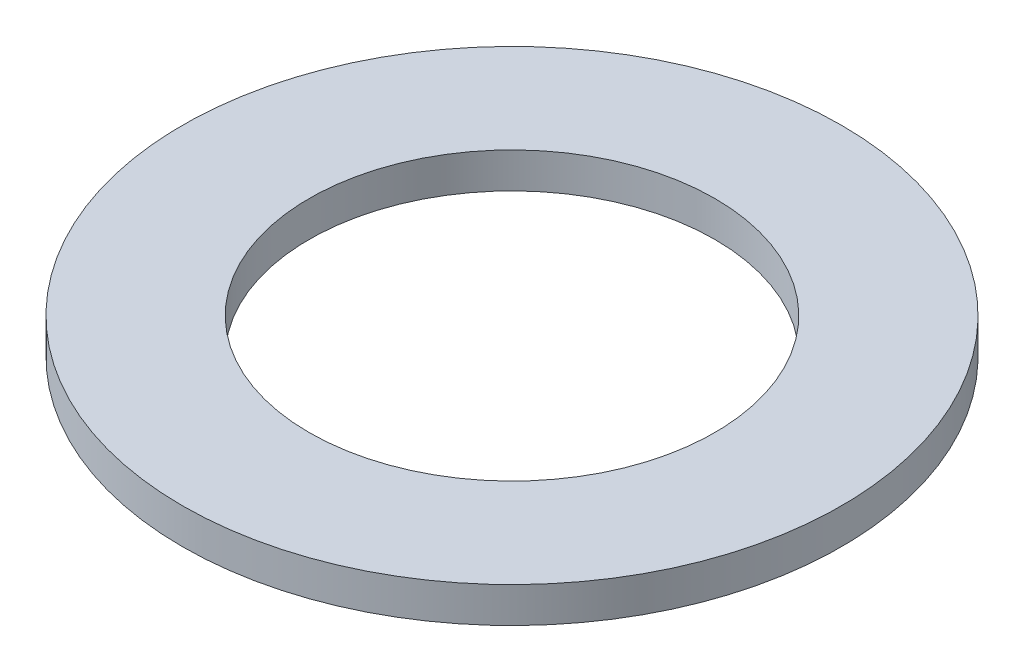
from build123d import *

# Parameters (mm, degrees)
SKETCH1_R           = 65
BOSS_EXTRUDE1_DEPTH = 7
SKETCH2_R           = 40
CUT_EXTRUDE1_DEPTH  = 93.190021152


with BuildPart() as part:
    # Sketch1 → Boss-Extrude1 (new body)
    with BuildSketch(Plane(origin=(0, 0, 0), x_dir=(1, 0, 0), z_dir=(0, 1, 0))):
        Circle(SKETCH1_R)
    extrude(amount=BOSS_EXTRUDE1_DEPTH)

    # Sketch2 → Cut-Extrude1 (cut, through all)
    with BuildSketch(Plane(origin=(0, 0, 0), x_dir=(1, 0, 0), z_dir=(0, 1, 0))):
        Circle(SKETCH2_R)
    extrude(amount=CUT_EXTRUDE1_DEPTH, mode=Mode.SUBTRACT)


solid = part.part
